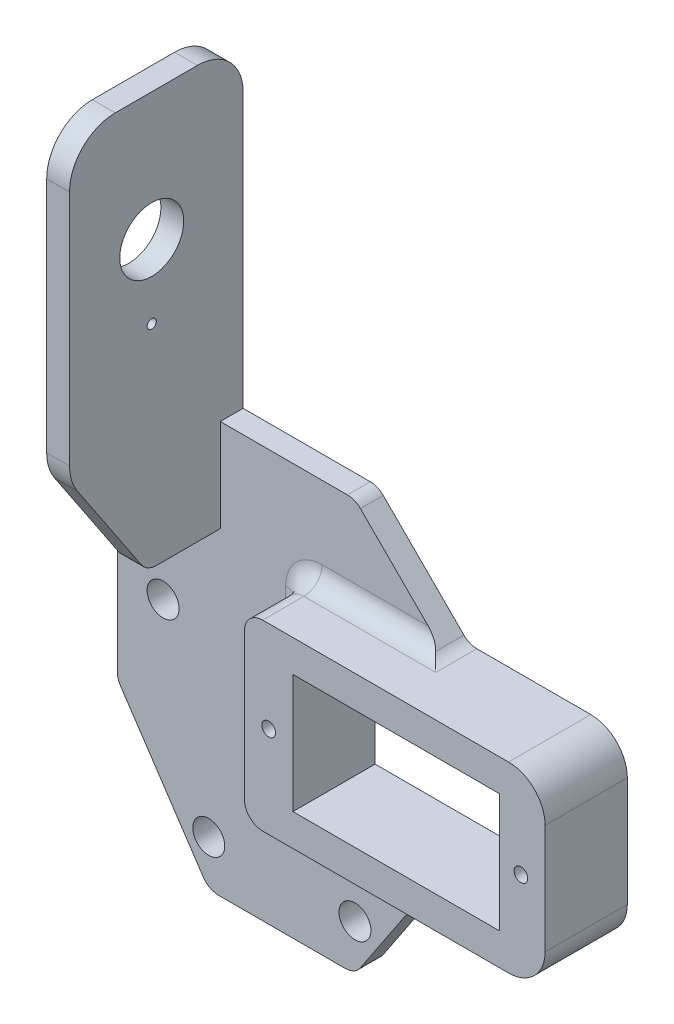
from build123d import *

# Parameters (mm, degrees)
BOSS_EXTRUDE1_DEPTH = 2.5
SKETCH6_R           = 1.75
SKETCH6_W           = 10.8
SKETCH6_H           = 10.8
CUT_EXTRUDE1_DEPTH  = 50.137003564
FILLET1_R           = 5.4
FILLET2_R           = 5.4
FILLET3_RADIUS      = 10
FILLET3_LENGTH      = 2.5
SKETCH7_W           = 35
SKETCH7_H           = 20
SKETCH7_W_2         = 23
SKETCH7_H_2         = 13
BOSS_EXTRUDE2_DEPTH = 6.5
CUT_EXTRUDE2_DEPTH  = 5.5
FILLET4_R           = 4
SKETCH9_W           = 2.5
SKETCH9_H           = 24
BOSS_EXTRUDE3_DEPTH = 35
SKETCH11_R          = 3.5
SKETCH11_R_2        = 0.5
CUT_EXTRUDE3_DEPTH  = 72.106548013
FILLET5_R           = 5
BOSS_EXTRUDE4_DEPTH = 2.5
CUT_EXTRUDE5_DEPTH  = 73.478504536
SKETCH17_W          = 5.3
SKETCH17_H          = 13
SKETCH17_R          = 0.75
BOSS_EXTRUDE5_DEPTH = 6.5
BOSS_EXTRUDE6_DEPTH = 9
SKETCH22_W          = 12.144268415
SKETCH22_H          = 32.489830624
CUT_EXTRUDE11_DEPTH = 75.735546033
FILLET11_R          = 5
SKETCH23_R          = 0.75
CUT_EXTRUDE12_DEPTH = 6.5
FILLET12_R          = 4
SKETCH24_W          = 4.9
SKETCH24_H          = 13
CUT_EXTRUDE13_DEPTH = 6.5
SKETCH26_W          = 22.6
SKETCH26_H          = 13
CUT_EXTRUDE14_DEPTH = 10
SKETCH29_W          = 6
SKETCH29_H          = 20
CUT_EXTRUDE15_DEPTH = 6.5
FILLET13_R          = 2
FILLET14_R          = 2


# Some blends are built 0.0001 mm under size
with BuildPart() as part:
    # Sketch1 → Boss-Extrude1 (new body)
    with BuildSketch(Plane.XY):
        Polygon((17.783093717, 10), (17.783093717, -10), (-6.22432909, -10), (-16.225555947, -25.001878594), (-32.225555947, -25.001878594), (-42.226782805, -10), (-42.221702947, 4.99999914), (-32.215396169, 19.998489886), (-16.215396169, 19.998489886), (-6.216906283, 10), align=None)
    extrude(amount=BOSS_EXTRUDE1_DEPTH)

    # Sketch6 → Cut-Extrude1 (cut, through all)
    with BuildSketch(Plane.XY.offset(2.5)):
        with Locations((-37.223395946, 0)):
            Circle(SKETCH6_R)
        with Locations((-32.225555947, -20.001878594)):
            Circle(SKETCH6_R)
        with Locations((-16.225555947, -20.001878594)):
            Circle(SKETCH6_R)
        with Locations((-10.316906283, 0)):
            Rectangle(SKETCH6_W, SKETCH6_H)
    extrude(amount=-CUT_EXTRUDE1_DEPTH, mode=Mode.SUBTRACT)

    # Fillet1
    fillet1_edges = [part.edges().sort_by_distance(p)[0] for p in [
        (-15.716906283, -5.4, 1.25),
        (-15.716906283, 5.4, 1.25),
    ]]
    fillet(fillet1_edges, radius=FILLET1_R - 0.0001)  # a hair under: the kernel refuses the full size

    # Fillet2
    # the kernel refuses this fillet: 5.4 mm, written as the material it adds along each edge
    with BuildSketch(Plane(origin=(-4.916906283, 5.4, 2.5), x_dir=(0, -1, 0), z_dir=(0, 0, -1)), Plane(origin=(-4.916906283, -5.4, 2.5), x_dir=(-1, 0, 0), z_dir=(0, 0, -1))) as fillet2_piece_1:
        with BuildLine():
            CenterArc((FILLET2_R, FILLET2_R), FILLET2_R, 180, 90)
            Line((0, FILLET2_R), (0, 0))
            Line((0, 0), (FILLET2_R, 0))
        make_face()
    extrude(amount=2.5)
    # the kernel refuses this fillet: 5.4 mm, written as the material it takes off along each edge

    # Fillet3: full round fillet: the end face becomes a half cylinder, R = half its width
    fillet3_face = Plane((17.783093717, 0, 1.25), x_dir=(0, 0, 1), z_dir=(1, 0, 0))  # on the end face: x along it, z out of the body
    fillet3_slab = fillet3_face.offset(-FILLET3_RADIUS / 2) * Box(FILLET3_LENGTH, 2 * FILLET3_RADIUS, FILLET3_RADIUS, mode=Mode.PRIVATE)  # the body's end, R deep
    fillet3_round = Plane((7.783093717, 0, 1.25), x_dir=(1, 0, 0), z_dir=(0, 0, 1)) * Cylinder(FILLET3_RADIUS, FILLET3_LENGTH, mode=Mode.PRIVATE)  # its axis R under the face
    add(fillet3_slab - fillet3_round, mode=Mode.SUBTRACT)

    # Sketch7 → Boss-Extrude2 (add)
    with BuildSketch(Plane.XY.offset(2.5)):
        with Locations((-10.316906283, 0)):
            Rectangle(SKETCH7_W, SKETCH7_H)
        with Locations((-10.316906283, 0)):
            Rectangle(SKETCH7_W_2, SKETCH7_H_2, mode=Mode.SUBTRACT)
    extrude(amount=BOSS_EXTRUDE2_DEPTH)

    # Sketch8 → Cut-Extrude2 (cut)
    with BuildSketch(Plane.XY.offset(2.5)):
        with BuildLine():
            Line((7.183093717, 10), (7.183093717, -10))
            Line((7.183093717, -10), (7.783093717, -10))
            ThreePointArc((7.783093717, -10), (17.783093717, 0), (7.783093717, 10))
            Line((7.783093717, 10), (7.183093717, 10))
        make_face()
    extrude(amount=-CUT_EXTRUDE2_DEPTH, mode=Mode.SUBTRACT)

    # Fillet4
    fillet4_edges = [part.edges().sort_by_distance(p)[0] for p in [
        (7.183093717, -10, 4.5),
        (7.183093717, 10, 4.5),
    ]]
    fillet(fillet4_edges, radius=FILLET4_R)

    # Sketch9 → Boss-Extrude3 (add)
    with BuildSketch(Plane(origin=(0, 19.998489886, 0), x_dir=(1, 0, 0), z_dir=(0, 1, 0))):
        with Locations((-32.215396169, -12)):
            Rectangle(SKETCH9_W, SKETCH9_H)
    extrude(amount=BOSS_EXTRUDE3_DEPTH)

    # Sketch11 → Cut-Extrude3 (cut, through all)
    with BuildSketch(Plane(origin=(-30.965396169, 0, 0), x_dir=(0, 0, -1), z_dir=(1, 0, 0))):
        with Locations(Location((-10, 40.998489886, 0), (0, 0, 90))):
            Circle(SKETCH11_R)
        with Locations(Location((-10, 32.998489886, 0), (0, 0, 90))):
            Circle(SKETCH11_R_2)
    extrude(amount=-CUT_EXTRUDE3_DEPTH, mode=Mode.SUBTRACT)

    # Fillet5
    fillet5_edges = [part.edges().sort_by_distance(p)[0] for p in [
        (-32.215396169, 54.998489886, 0),
        (-32.215396169, 54.998489886, 24),
    ]]
    fillet(fillet5_edges, radius=FILLET5_R)

    # Sketch14 → Boss-Extrude4 (add)
    with BuildSketch(Plane(origin=(-30.965396169, 0, 0), x_dir=(0, 0, -1), z_dir=(1, 0, 0))):
        Polygon((-24, 19.998489886), (-10.54641456, 9.845474641), (0, 9.845474641), (0, 19.998489886), align=None)
    extrude(amount=-BOSS_EXTRUDE4_DEPTH)

    # Sketch16 → Cut-Extrude5 (cut, through all)
    with BuildSketch(Plane.ZY.offset(33.465396169)):
        Polygon((10.54641456, 9.845474641), (24, 29.998489886), (24, 19.998489886), align=None)
    extrude(amount=-CUT_EXTRUDE5_DEPTH, mode=Mode.SUBTRACT)

    # Sketch17 → Boss-Extrude5 (add)
    with BuildSketch(Plane.XY.offset(2.5)):
        with Locations((-19.166906283, 0)):
            Rectangle(SKETCH17_W, SKETCH17_H)
        with Locations(Location((-19.166906283, 0, 0), (0, 0, 180))):
            Circle(SKETCH17_R, mode=Mode.SUBTRACT)
    extrude(amount=BOSS_EXTRUDE5_DEPTH)

    # Sketch18 → Boss-Extrude6 (add)
    with BuildSketch(Plane.XY.offset(9)):
        with BuildLine():
            Line((3.183093717, 10), (11.083093717, 10))
            Line((11.083093717, 10), (11.083093717, -10))
            Line((11.083093717, -10), (3.183093717, -10))
            ThreePointArc((3.183093717, -10), (6.011520842, -8.828427125), (7.183093717, -6))
            Line((7.183093717, -6), (7.183093717, 6))
            ThreePointArc((7.183093717, 6), (6.011520842, 8.828427125), (3.183093717, 10))
        make_face()
    extrude(amount=-BOSS_EXTRUDE6_DEPTH)

    # Sketch22 → Cut-Extrude11 (cut, through all)
    with BuildSketch(Plane.ZY.offset(33.465396169)):
        with Locations((25.072134207, 38.753574574)):
            Rectangle(SKETCH22_W, SKETCH22_H)
    extrude(amount=-CUT_EXTRUDE11_DEPTH, mode=Mode.SUBTRACT)

    # Fillet11
    fillet11_edges = [part.edges().sort_by_distance(p)[0] for p in [
        (-32.215396169, 54.998489886, 19),
        (-32.215396169, 22.508659262, 19),
    ]]
    fillet(fillet11_edges, radius=FILLET11_R)

    # Sketch23 → Cut-Extrude12 (cut)
    with BuildSketch(Plane.XY.offset(9)):
        with Locations((8.433093717, 0)):
            Circle(SKETCH23_R)
    extrude(amount=-CUT_EXTRUDE12_DEPTH, mode=Mode.SUBTRACT)

    # Fillet12
    fillet12_edges = [part.edges().sort_by_distance(p)[0] for p in [
        (11.083093717, -10, 4.5),
        (11.083093717, 10, 4.5),
    ]]
    fillet(fillet12_edges, radius=FILLET12_R)

    # Sketch24 → Cut-Extrude13 (cut)
    with BuildSketch(Plane.XY.offset(9)):
        with Locations((3.633093717, 0)):
            Rectangle(SKETCH24_W, SKETCH24_H)
    extrude(amount=-CUT_EXTRUDE13_DEPTH, mode=Mode.SUBTRACT)

    # Sketch26 → Cut-Extrude14 (cut)
    with BuildSketch(Plane.XY.offset(2.5)):
        with Locations((-5.216906283, 0)):
            Rectangle(SKETCH26_W, SKETCH26_H)
    extrude(amount=-CUT_EXTRUDE14_DEPTH, mode=Mode.SUBTRACT)

    # Sketch29 → Cut-Extrude15 (cut)
    with BuildSketch(Plane.XY.offset(9)):
        with Locations((-24.816906283, 0)):
            Rectangle(SKETCH29_W, SKETCH29_H)
    extrude(amount=-CUT_EXTRUDE15_DEPTH, mode=Mode.SUBTRACT)

    # Fillet13
    fillet13_edges = [part.edges().sort_by_distance(p)[0] for p in [
        (-6.22432909, -10, 1.25),
        (-16.225555947, -25.001878594, 1.25),
        (-32.225555947, -25.001878594, 1.25),
        (-42.226782805, -10, 1.25),
        (-42.221702947, 4.99999914, 1.25),
        (-16.215396169, 19.998489886, 1.25),
        (-6.216906283, 10, 1.25),
        (-33.465396169, 18.124860199, 1.25),
        (-14.020617686, -10, 2.5),
        (-21.816906283, -10, 5.75),
        (-21.816906283, 0, 2.5),
        (-21.816906283, 10, 5.75),
        (-14.016906283, 10, 2.5),
    ]]
    fillet(fillet13_edges, radius=FILLET13_R)

    # Fillet14
    fillet14_edges = [part.edges().sort_by_distance(p)[0] for p in [
        (-32.215396169, 9.845474641, 10.54641456),
    ]]
    fillet(fillet14_edges, radius=FILLET14_R)


solid = part.part
